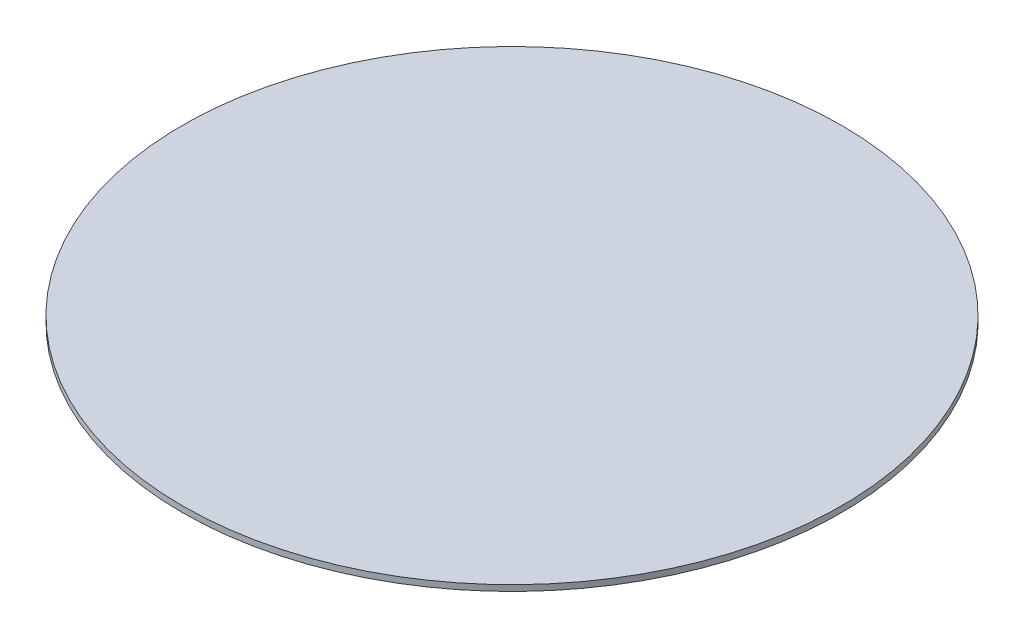
from build123d import *

# Parameters (mm, degrees)
EXTRUDE_START       = -10
EXTRUDE_1_OUTLINE_R = 557.427463001
EXTRUDE_1_DEPTH     = 10


# Read off the part's stored shape, not the designer's step: 凸台-拉伸1
with BuildPart() as part:
    # 凸台-拉伸1 outline → 凸台-拉伸1 (new body)
    with BuildSketch(Plane(origin=(0, 0, 0), x_dir=(1, 0, 0), z_dir=(0, 1, 0)).offset(EXTRUDE_START)):
        Circle(EXTRUDE_1_OUTLINE_R)
    extrude(amount=EXTRUDE_1_DEPTH)


solid = part.part
